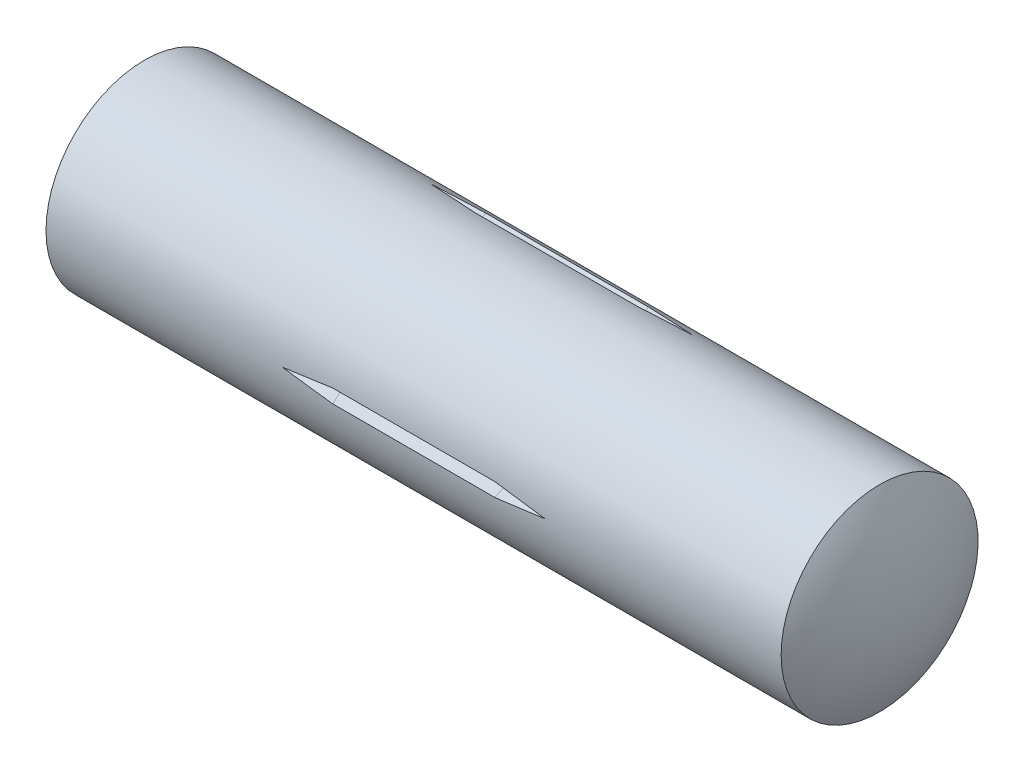
from build123d import *

# Parameters (mm, degrees)
CIRPATTERN2_COUNT = 3


with BuildPart() as part:
    # Sketch1 → Base-Revolve (revolve)
    with BuildSketch(Plane.XY):
        with BuildLine():
            Line((-50, 0), (-50, 1.25))
            ThreePointArc((-50, 1.25), (-49.010050505, 7.072345027), (-46.68190465, 12.5))
            Line((-46.68190465, 12.5), (46.650635095, 12.5))
            ThreePointArc((46.650635095, 12.5), (49.148145657, 6.470476128), (50, 0))
            Line((50, 0), (-50, 0))
        make_face()
    revolve(axis=Axis((-57, 0, 0), (1, 0, 0)))

    # Cut-Sweep3: sweep along a path in Sketch3
    with BuildLine(Plane(origin=(0, 0, 0), x_dir=(1, 0, 0), z_dir=(0, 1, 0))) as cut_sweep3_path:
        Line((-16.666666667, -12.5), (-10.416666667, -11.25))
        Line((-10.416666667, -11.25), (10.416666667, -11.25))
        Line((10.416666667, -11.25), (16.666666667, -12.5))
    # Sketch4 → Cut-Sweep3 (sweep, cut)
    with BuildSketch(Plane(origin=(-16.666666667, 0, 0), x_dir=(0, 0, -1), z_dir=(1, 0, 0))):
        Polygon((-12.5, 0), (-14.378358908, 1.315241067), (-14.378358908, -1.315241067), align=None)
    cut_sweep3 = sweep(path=cut_sweep3_path.line, transition=Transition.RIGHT, mode=Mode.SUBTRACT)

    # CirPattern2: Cut-Sweep3 ×3 about axis
    cirpattern2_axis = Axis((-57, 0, 0), (1, 0, 0))
    for i in range(1, CIRPATTERN2_COUNT):
        add(cut_sweep3.rotate(cirpattern2_axis, i * 360 / CIRPATTERN2_COUNT), mode=Mode.SUBTRACT)


solid = part.part
